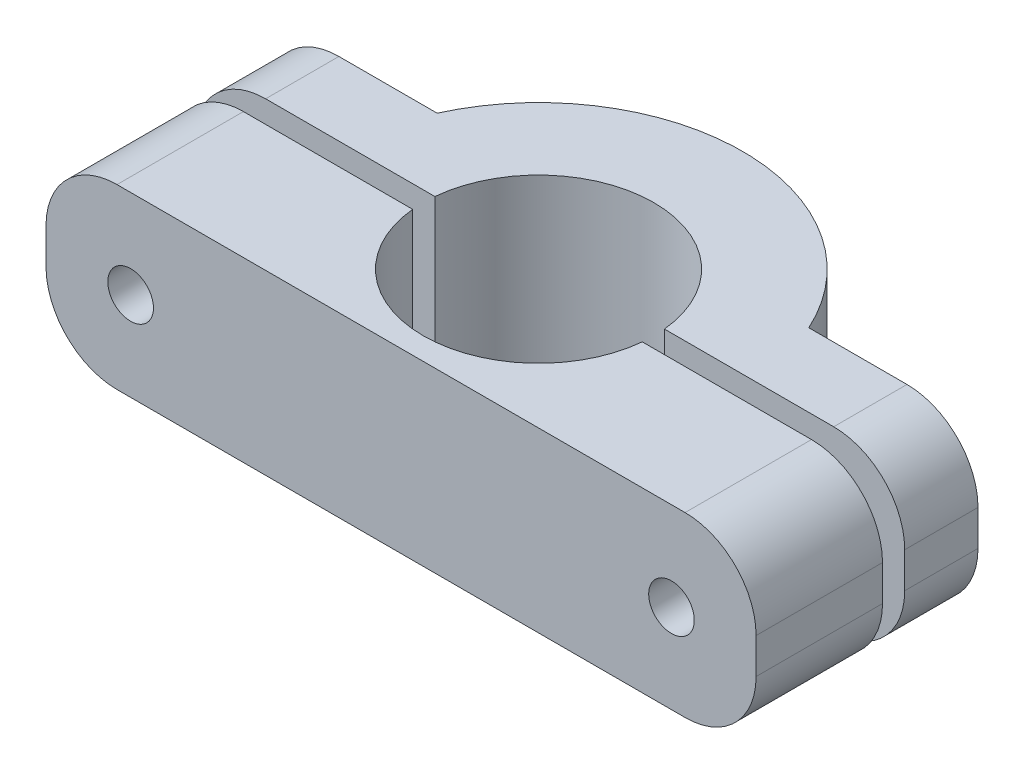
from build123d import *

# Parameters (mm, degrees)
SKETCH1_R           = 8.25
BOSS_EXTRUDE1_DEPTH = 12.7
SKETCH6_R           = 1.63195
CUT_EXTRUDE1_DEPTH  = 33.534068682
FILLET1_R           = 5.08
SPLIT2_START        = -14.6
SPLIT2_OUTLINE_R    = 1.63195
SPLIT2_DEPTH        = 13.80625
SPLIT2_2_DEPTH      = 12.7
SPLIT2_START_2      = -16
SPLIT2_3_OUTLINE_R  = 1.63195
SPLIT2_3_DEPTH      = 16.79375
SPLIT2_4_DEPTH      = 12.7
SPLIT2_START_3      = -0.79375
SPLIT2_5_OUTLINE_R  = 1.63195
SPLIT2_5_DEPTH      = 1.5875
SPLIT2_6_DEPTH      = 12.7
SPLIT2_7_OUTLINE_R  = 1.63195
SPLIT2_7_DEPTH      = 1.5875


with BuildPart() as part:
    # Sketch1 → Boss-Extrude1 (new body)
    with BuildSketch(Plane(origin=(0, 0, 0), x_dir=(1, 0, 0), z_dir=(0, 1, 0))):
        with BuildLine():
            Line((-25.4, -9.8375), (25.4, -9.8375))
            Line((25.4, -9.8375), (25.4, 6.0375))
            Line((25.4, 6.0375), (13.293178467, 6.0375))
            ThreePointArc((13.293178467, 6.0375), (0, 14.6), (-13.293178467, 6.0375))
            Line((-13.293178467, 6.0375), (-25.4, 6.0375))
            Line((-25.4, 6.0375), (-25.4, -9.8375))
        make_face()
        with Locations(Location((0, 0, 0), (0, 0, 270))):
            Circle(SKETCH1_R, mode=Mode.SUBTRACT)
    extrude(amount=BOSS_EXTRUDE1_DEPTH)

    # Sketch6 → Cut-Extrude1 (cut, through all)
    with BuildSketch(Plane(origin=(0, 0, -6.0375), x_dir=(-1, 0, 0), z_dir=(0, 0, -1))):
        with Locations((-19.346589233, 6.35)):
            Circle(SKETCH6_R)
        with Locations(Location((19.346589233, 6.35, 0), (0, 0, 180))):
            Circle(SKETCH6_R)
    extrude(amount=-CUT_EXTRUDE1_DEPTH, mode=Mode.SUBTRACT)

    # Fillet1
    fillet1_edges = [part.edges().sort_by_distance(p)[0] for p in [
        (-25.4, 12.7, 1.9),
        (25.4, 12.7, 1.9),
        (-25.4, 0, 1.9),
        (25.4, 0, 1.9),
    ]]
    fillet(fillet1_edges, radius=FILLET1_R)

    # Split2 3 outline → Split2 3 (cut)
    with BuildSketch(Plane.XY.offset(SPLIT2_START_2)):
        with BuildLine():
            ThreePointArc((25.4, 7.62), (23.912102448, 11.212102448), (20.32, 12.7))
            Line((20.32, 12.7), (-20.32, 12.7))
            ThreePointArc((-20.32, 12.7), (-23.912102448, 11.212102448), (-25.4, 7.62))
            Line((-25.4, 7.62), (-25.4, 5.08))
            ThreePointArc((-25.4, 5.08), (-23.912102448, 1.487897552), (-20.32, 0))
            Line((-20.32, 0), (20.32, 0))
            ThreePointArc((20.32, 0), (23.912102448, 1.487897552), (25.4, 5.08))
            Line((25.4, 5.08), (25.4, 7.62))
        make_face()
        with Locations((-19.346589233, 6.35)):
            Circle(SPLIT2_3_OUTLINE_R, mode=Mode.SUBTRACT)
        with Locations((19.346589233, 6.35)):
            Circle(SPLIT2_3_OUTLINE_R, mode=Mode.SUBTRACT)
    extrude(amount=SPLIT2_3_DEPTH, mode=Mode.SUBTRACT)


with BuildPart() as body_2:
    # Split2: read off the stored shape, not the designer's step
    # Split2 outline → Split2 (new body)
    with BuildSketch(Plane.XY.offset(SPLIT2_START)):
        with BuildLine():
            Line((-20.32, 0), (20.32, 0))
            ThreePointArc((20.32, 0), (23.912102448, 1.487897552), (25.4, 5.08))
            Line((25.4, 5.08), (25.4, 7.62))
            ThreePointArc((25.4, 7.62), (23.912102448, 11.212102448), (20.32, 12.7))
            Line((20.32, 12.7), (-20.32, 12.7))
            ThreePointArc((-20.32, 12.7), (-23.912102448, 11.212102448), (-25.4, 7.62))
            Line((-25.4, 7.62), (-25.4, 5.08))
            ThreePointArc((-25.4, 5.08), (-23.912102448, 1.487897552), (-20.32, 0))
        make_face()
        with Locations((-19.346589233, 6.35)):
            Circle(SPLIT2_OUTLINE_R, mode=Mode.SUBTRACT)
        with Locations((19.346589233, 6.35)):
            Circle(SPLIT2_OUTLINE_R, mode=Mode.SUBTRACT)
    extrude(amount=SPLIT2_DEPTH)

    # Split2 2 outline → Split2 2 (cut)
    with BuildSketch(Plane(origin=(0, 0, 0), x_dir=(1, 0, 0), z_dir=(0, 1, 0))):
        with BuildLine():
            Line((-25.4, 6.0375), (-13.293178467, 6.0375))
            ThreePointArc((-13.293178467, 6.0375), (-7.906089425, 12.274108929), (0, 14.6))
            Line((0, 14.6), (-25.4, 14.6))
            Line((-25.4, 14.6), (-25.4, 6.0375))
        make_face()
        with BuildLine():
            Line((25.4, 14.6), (0, 14.6))
            ThreePointArc((0, 14.6), (7.906089425, 12.274108929), (13.293178467, 6.0375))
            Line((13.293178467, 6.0375), (25.4, 6.0375))
            Line((25.4, 6.0375), (25.4, 14.6))
        make_face()
        with BuildLine():
            ThreePointArc((8.211727037, 0.79375), (0, 8.25), (-8.211727037, 0.79375))
            Line((-8.211727037, 0.79375), (8.211727037, 0.79375))
        make_face()
    extrude(amount=SPLIT2_2_DEPTH, mode=Mode.SUBTRACT)


with BuildPart() as body_3:
    # Split2 4 outline → Split2 4 (new body)
    with BuildSketch(Plane(origin=(0, 0, 0), x_dir=(1, 0, 0), z_dir=(0, 1, 0))):
        with BuildLine():
            Line((25.4, 0.79375), (8.211727037, 0.79375))
            ThreePointArc((8.211727037, 0.79375), (8.25, 0), (8.211727037, -0.79375))
            Line((8.211727037, -0.79375), (25.4, -0.79375))
            Line((25.4, -0.79375), (25.4, 0.79375))
        make_face()
    extrude(amount=SPLIT2_4_DEPTH)

    # Split2 5 outline → Split2 5 (cut)
    with BuildSketch(Plane.XY.offset(SPLIT2_START_3)):
        with BuildLine():
            ThreePointArc((20.32, 12.7), (23.912102448, 11.212102448), (25.4, 7.62))
            Line((25.4, 7.62), (25.4, 12.7))
            Line((25.4, 12.7), (20.32, 12.7))
        make_face()
        with BuildLine():
            Line((25.4, 0), (25.4, 5.08))
            ThreePointArc((25.4, 5.08), (23.912102448, 1.487897552), (20.32, 0))
            Line((20.32, 0), (25.4, 0))
        make_face()
        with Locations((19.346589233, 6.35)):
            Circle(SPLIT2_5_OUTLINE_R)
    extrude(amount=SPLIT2_5_DEPTH, mode=Mode.SUBTRACT)


with BuildPart() as body_4:
    # Split2 6 outline → Split2 6 (new body)
    with BuildSketch(Plane(origin=(0, 0, 0), x_dir=(1, 0, 0), z_dir=(0, 1, 0))):
        with BuildLine():
            Line((-8.211727037, 0.79375), (-25.4, 0.79375))
            Line((-25.4, 0.79375), (-25.4, -0.79375))
            Line((-25.4, -0.79375), (-8.211727037, -0.79375))
            ThreePointArc((-8.211727037, -0.79375), (-8.25, 0), (-8.211727037, 0.79375))
        make_face()
    extrude(amount=SPLIT2_6_DEPTH)

    # Split2 7 outline → Split2 7 (cut)
    with BuildSketch(Plane.XY.offset(SPLIT2_START_3)):
        with BuildLine():
            Line((-25.4, 12.7), (-25.4, 7.62))
            ThreePointArc((-25.4, 7.62), (-23.912102448, 11.212102448), (-20.32, 12.7))
            Line((-20.32, 12.7), (-25.4, 12.7))
        make_face()
        with BuildLine():
            ThreePointArc((-20.32, 0), (-23.912102448, 1.487897552), (-25.4, 5.08))
            Line((-25.4, 5.08), (-25.4, 0))
            Line((-25.4, 0), (-20.32, 0))
        make_face()
        with Locations((-19.346589233, 6.35)):
            Circle(SPLIT2_7_OUTLINE_R)
    extrude(amount=SPLIT2_7_DEPTH, mode=Mode.SUBTRACT)


solid = Compound([part.part, body_2.part])
